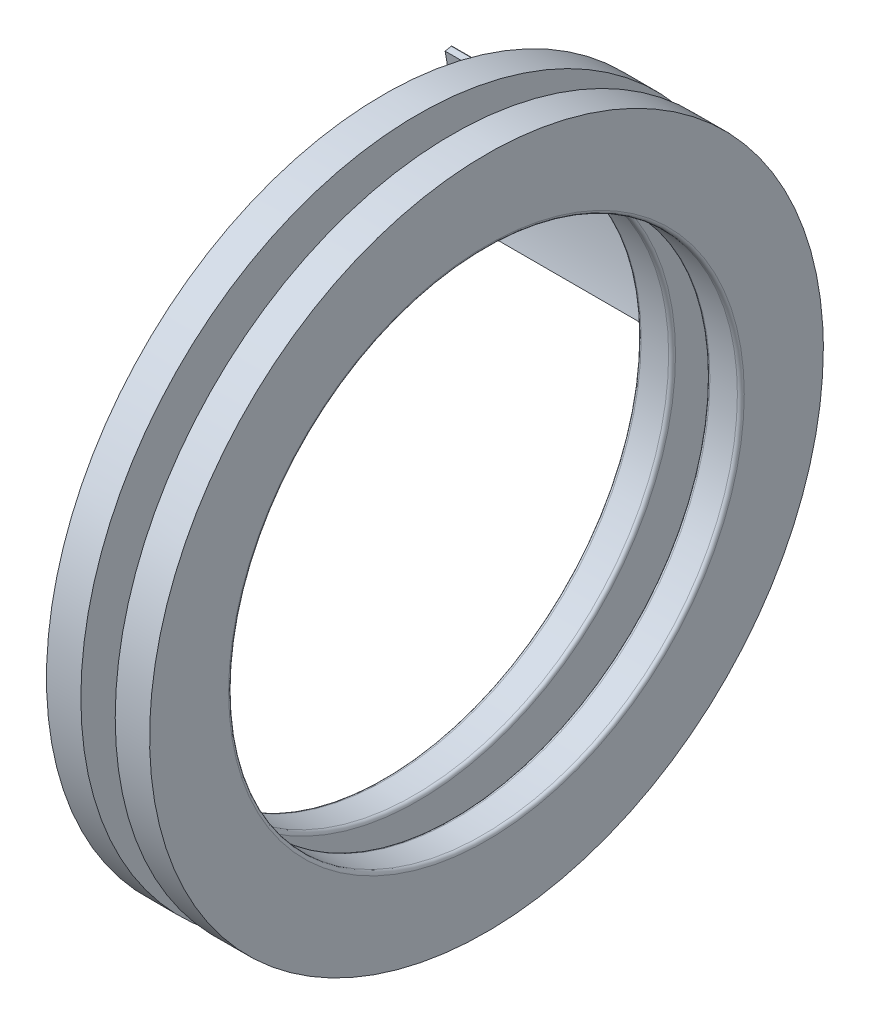
from build123d import *

# Parameters (mm, degrees)
BOSS_EXTRUDE1_DEPTH     = 50
FILLET3_R               = 0.1
BOSS_EXTRUDE2_DEPTH     = 5
FILLET4_R               = 0.5
SET_RING_R              = 49.009696876
SET_RING_R_2            = 37.009696876
SETRING_DEPTH           = 5
FILLET5_R               = 0.5
CUT_EXTRUDE1_DEPTH      = 90.598830282
CUT_EXTRUDE1_DEPTH_BACK = 90.598830282
CUTOUT_HINGE_R          = 2


with BuildPart() as part:
    # airflap → Boss-Extrude1 (new body)
    with BuildSketch(Plane(origin=(0, 0, 0), x_dir=(0, 0, -1), z_dir=(1, 0, 0))):
        with BuildLine():
            Line((49.969590753, 10.2), (48.989794856, 10))
            ThreePointArc((48.989794856, 10), (50, 0), (48.989794856, -10))
            Line((48.989794856, -10), (49.969590753, -10.2))
            ThreePointArc((49.969590753, -10.2), (51, 0), (49.969590753, 10.2))
        make_face()
    extrude(amount=BOSS_EXTRUDE1_DEPTH)

    # Fillet3
    fillet3_edges = [part.edges().sort_by_distance(p)[0] for p in [
        (50, 10.1, -49.479692804),
        (50, -10.1, -49.479692804),
        (25, -10.2, -49.969590753),
        (25, 10.2, -49.969590753),
        (50, 0, -51),
    ]]
    fillet(fillet3_edges, radius=FILLET3_R)



with BuildPart() as body_2:
    # inner-hinge → Boss-Extrude2 (new body)
    with BuildSketch(Plane(origin=(50, 0, 0), x_dir=(0, 0, -1), z_dir=(1, 0, 0))):
        with BuildLine():
            Line((49.009696876, 3), (42.009696876, 3))
            Line((42.009696876, 3), (42.009696876, -3))
            Line((42.009696876, -3), (49.009696876, -3))
            Line((49.009696876, -3), (49.909918854, -3))
            ThreePointArc((49.909918854, -3), (50, 0), (49.909918854, 3))
            Line((49.909918854, 3), (49.009696876, 3))
        make_face()
    extrude(amount=-BOSS_EXTRUDE2_DEPTH)

    # Fillet4
    fillet4_edges = [body_2.edges().sort_by_distance(p)[0] for p in [
        (50, 0, -42.009696876),
        (45, 0, -42.009696876),
    ]]
    fillet(fillet4_edges, radius=FILLET4_R)


with BuildPart() as part_1:
    add(part.part)

    add(body_2.part)  # setring merges body 2
    # set ring → setring (add)
    with BuildSketch(Plane(origin=(50, 0, 0), x_dir=(0, 0, -1), z_dir=(1, 0, 0))):
        Circle(SET_RING_R)
        Circle(SET_RING_R_2, mode=Mode.SUBTRACT)
    setring = extrude(amount=SETRING_DEPTH)

    # Mirror1: setring across plane
    add(setring.mirror(Plane(origin=(47.5, 0, 0), x_dir=(0, 0, 1), z_dir=(1, 0, 0))))

    # Fillet5
    fillet5_edges = [part_1.edges().sort_by_distance(p)[0] for p in [
        (40, 0, 37.009696876),
        (45, 0, 37.009696876),
        (50, 0, 37.009696876),
        (55, 0, 37.009696876),
    ]]
    fillet(fillet5_edges, radius=FILLET5_R)

    # cutout-hinge → Cut-Extrude1 (cut, two sides: drawn at the far end of the back side and taken through both)
    with BuildSketch(Plane(origin=(0, 0, 0), x_dir=(1, 0, 0), z_dir=(0, 1, 0)).offset(-CUT_EXTRUDE1_DEPTH_BACK)):
        with BuildLine():
            Line((45, 42.009696876), (50, 42.009696876))
            Line((50, 42.009696876), (50, 46.004848438))
            ThreePointArc((50, 46.004848438), (47.5, 43.504848438), (45, 46.004848438))
            Line((45, 46.004848438), (45, 42.009696876))
        make_face()
        with Locations((47.5, 46.004848438)):
            Circle(CUTOUT_HINGE_R)
    extrude(amount=CUT_EXTRUDE1_DEPTH + CUT_EXTRUDE1_DEPTH_BACK, mode=Mode.SUBTRACT)


solid = part_1.part
